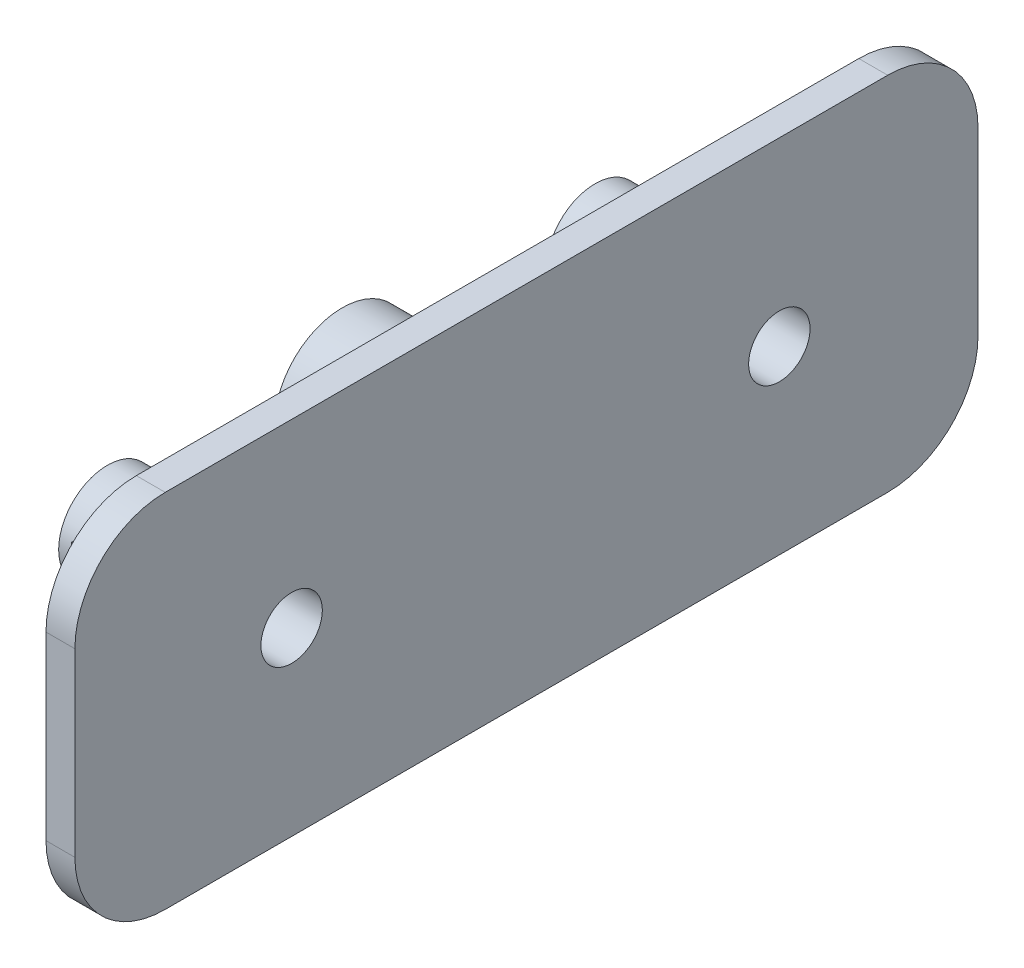
from build123d import *
from build123d.topology import SkipClean

# Parameters (mm, degrees)
SKETCH1_R                = 3.75
SKETCH1_R_2              = 2.5
BOSS_EXTRUDE1_DEPTH      = 5
SKETCH2_W                = 40
SKETCH2_H                = 10
SKETCH2_R                = 3
BOSS_EXTRUDE2_DEPTH      = 3.6
SKETCH7_W                = 50
SKETCH7_H                = 20
BOSS_EXTRUDE3_DEPTH      = 1.6
M3_CLEARANCE_HOLE1_D     = 3.4
M3_CLEARANCE_HOLE1_DEPTH = 12
M3_CLEARANCE_HOLE1_TIP   = 1.021463052
SKETCH8_R                = 2.7
SKETCH8_R_2              = 1.7
BOSS_EXTRUDE4_DEPTH      = 5
FILLET2_R                = 5


with BuildPart() as part:
    # Sketch1 → Boss-Extrude1 (new body)
    with BuildSketch(Plane(origin=(0, 0, 0), x_dir=(0, 0, -1), z_dir=(1, 0, 0))):
        Circle(SKETCH1_R)
        Circle(SKETCH1_R_2, mode=Mode.SUBTRACT)
    extrude(amount=BOSS_EXTRUDE1_DEPTH)

    # Sketch2 → Boss-Extrude2 (add)
    with BuildSketch(Plane(origin=(5, 0, 0), x_dir=(0, 0, -1), z_dir=(1, 0, 0))):
        Rectangle(SKETCH2_W, SKETCH2_H)
        Circle(SKETCH2_R, mode=Mode.SUBTRACT)
    extrude(amount=BOSS_EXTRUDE2_DEPTH)

    # Sketch7 → Boss-Extrude3 (add)
    with BuildSketch(Plane(origin=(8.6, 0, 0), x_dir=(0, 0, -1), z_dir=(1, 0, 0))):
        Rectangle(SKETCH7_W, SKETCH7_H)
    extrude(amount=BOSS_EXTRUDE3_DEPTH)

    # M3 Clearance Hole1
    with Locations(Plane.ZY.offset(-5)):
        with Locations((-14, 0), (13, 0)):
            Hole(M3_CLEARANCE_HOLE1_D / 2, depth=M3_CLEARANCE_HOLE1_DEPTH)
            with Locations((0, 0, -(M3_CLEARANCE_HOLE1_DEPTH + M3_CLEARANCE_HOLE1_TIP / 2))):  # 118° drill point
                Cone(0, M3_CLEARANCE_HOLE1_D / 2, M3_CLEARANCE_HOLE1_TIP, mode=Mode.SUBTRACT)

    # Sketch8 → Boss-Extrude4 (add)
    # profile 1 of 2: a face of its own
    with SkipClean():  # the faces are left unmerged after this step: merging them gives an invalid solid
        with BuildSketch(Plane.ZY.offset(-5)):
            with Locations((-14, 0)):
                Circle(SKETCH8_R)
            with Locations((-14, 0)):
                Circle(SKETCH8_R_2, mode=Mode.SUBTRACT)
        # profile 2 of 2: a face of its own
        with BuildSketch(Plane.ZY.offset(-5)):
            with Locations((13, 0)):
                Circle(SKETCH8_R)
            with Locations((13, 0)):
                Circle(SKETCH8_R_2, mode=Mode.SUBTRACT)
        extrude(amount=BOSS_EXTRUDE4_DEPTH)
    add(part.part.scale(1), mode=Mode.REPLACE)  # the faces are merged on a copy

    # Fillet2
    fillet2_edges = [part.edges().sort_by_distance(p)[0] for p in [
        (9.4, 10, -25),
        (9.4, -10, -25),
        (9.4, -10, 25),
        (9.4, 10, 25),
    ]]
    fillet(fillet2_edges, radius=FILLET2_R)


solid = part.part
